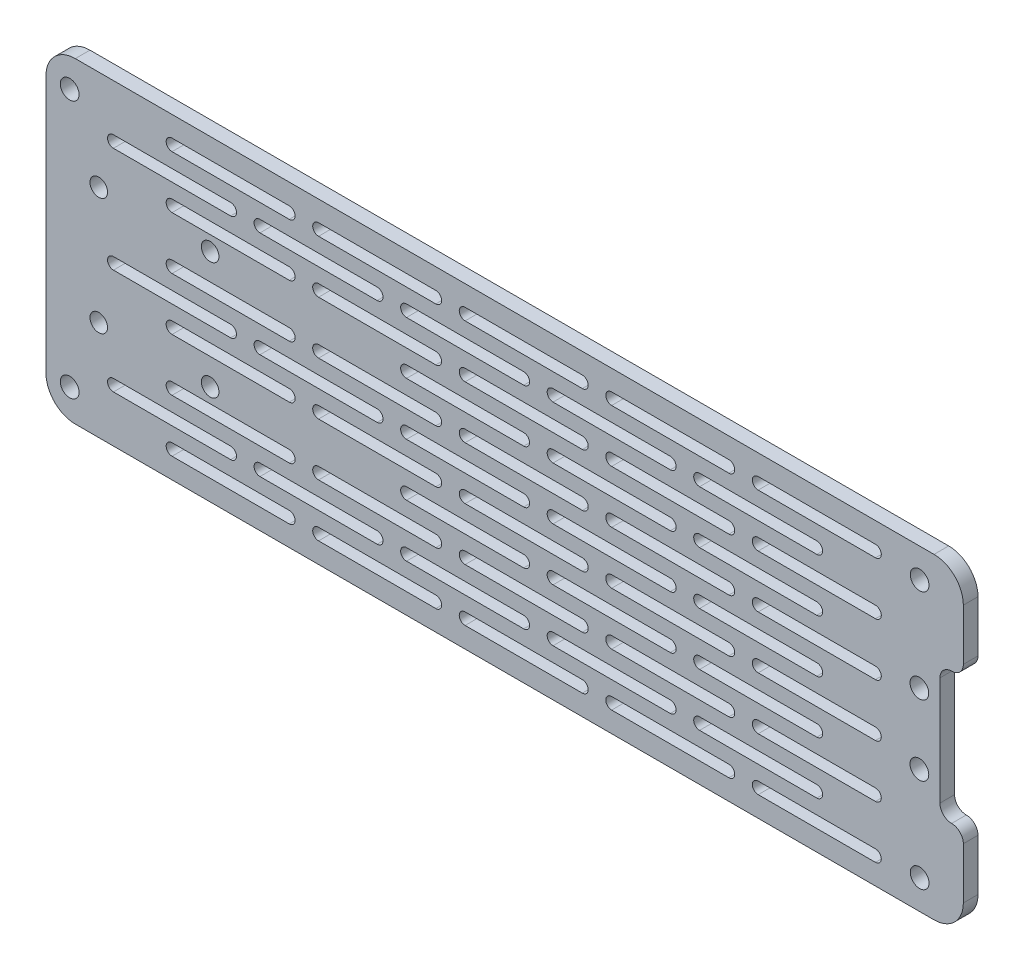
from build123d import *

# Parameters (mm, degrees)
SKETCH_1_W          = 156.5
SKETCH_1_H          = 54
EXTRUDE_1_DEPTH     = 2.5
FILLET_1_R          = 5
CUT_EXTRUDE_1_REACH = 159.625
SKETCH_2_R          = 1.6
SKETCH_2_W          = 4
SKETCH_2_H          = 22.5
SKETCH_2_R_2        = 1.5
FILLET_5_R          = 2
CUT_EXTRUDE_2_REACH = 159.625
SKETCH_3_R          = 1.6
CUT_EXTRUDE_3_DEPTH = 2.5


with BuildPart() as part:
    # 草图1 → 凸台-拉伸1 (new body)
    with BuildSketch(Plane.XY):
        with Locations((-74.950000012, 10)):
            Rectangle(SKETCH_1_W, SKETCH_1_H)
    extrude(amount=EXTRUDE_1_DEPTH)

    # 圆角1
    fillet_1_edges = [part.edges().sort_by_distance(p)[0] for p in [
        (3.299999988, -17, 1.25),
        (-153.200000012, -17, 1.25),
        (-153.200000012, 37, 1.25),
        (3.299999988, 37, 1.25),
    ]]
    fillet(fillet_1_edges, radius=FILLET_1_R)

    # 草图2 → 切除-拉伸1 (cut, up to next)
    with BuildSketch(Plane.XY.offset(2.5), mode=Mode.PRIVATE) as cut_extrude_1_sk1:
        with Locations(Location((-4.200000012, 16, 0), (0, 0, 180))):
            Circle(SKETCH_2_R)
    cut_extrude_1_tool1 = extrude(cut_extrude_1_sk1.sketch, amount=-CUT_EXTRUDE_1_REACH, mode=Mode.PRIVATE) & part.part
    # 草图2 → 切除-拉伸1 (cut, up to next)
    with BuildSketch(Plane.XY.offset(2.5), mode=Mode.PRIVATE) as cut_extrude_1_sk2:
        with Locations((-4.200000012, 4)):
            Circle(SKETCH_2_R)
    cut_extrude_1_tool2 = extrude(cut_extrude_1_sk2.sketch, amount=-CUT_EXTRUDE_1_REACH, mode=Mode.PRIVATE) & part.part
    # 草图2 → 切除-拉伸1 (cut, up to next)
    with BuildSketch(Plane.XY.offset(2.5), mode=Mode.PRIVATE) as cut_extrude_1_sk3:
        with Locations((1.299999988, 10)):
            Rectangle(SKETCH_2_W, SKETCH_2_H)
    cut_extrude_1_tool3 = extrude(cut_extrude_1_sk3.sketch, amount=-CUT_EXTRUDE_1_REACH, mode=Mode.PRIVATE) & part.part
    # 草图2 → 切除-拉伸1 (cut, up to next)
    with BuildSketch(Plane.XY.offset(2.5), mode=Mode.PRIVATE) as cut_extrude_1_sk4:
        with Locations((-144.200000012, 20)):
            Circle(SKETCH_2_R_2)
    cut_extrude_1_tool4 = extrude(cut_extrude_1_sk4.sketch, amount=-CUT_EXTRUDE_1_REACH, mode=Mode.PRIVATE) & part.part
    # 草图2 → 切除-拉伸1 (cut, up to next)
    with BuildSketch(Plane.XY.offset(2.5), mode=Mode.PRIVATE) as cut_extrude_1_sk5:
        with Locations((-125.200000012, 20)):
            Circle(SKETCH_2_R_2)
    cut_extrude_1_tool5 = extrude(cut_extrude_1_sk5.sketch, amount=-CUT_EXTRUDE_1_REACH, mode=Mode.PRIVATE) & part.part
    # 草图2 → 切除-拉伸1 (cut, up to next)
    with BuildSketch(Plane.XY.offset(2.5), mode=Mode.PRIVATE) as cut_extrude_1_sk6:
        with Locations(Location((-144.200000012, 0, 0), (0, 0, 180))):
            Circle(SKETCH_2_R_2)
    cut_extrude_1_tool6 = extrude(cut_extrude_1_sk6.sketch, amount=-CUT_EXTRUDE_1_REACH, mode=Mode.PRIVATE) & part.part
    # 草图2 → 切除-拉伸1 (cut, up to next)
    with BuildSketch(Plane.XY.offset(2.5), mode=Mode.PRIVATE) as cut_extrude_1_sk7:
        with Locations(Location((-125.200000012, 0, 0), (0, 0, 180))):
            Circle(SKETCH_2_R_2)
    cut_extrude_1_tool7 = extrude(cut_extrude_1_sk7.sketch, amount=-CUT_EXTRUDE_1_REACH, mode=Mode.PRIVATE) & part.part
    add(cut_extrude_1_tool1.solids().sort_by_distance((-4.2, 16, 2.5))[0], mode=Mode.SUBTRACT)
    add(cut_extrude_1_tool2.solids().sort_by_distance((-4.2, 4, 2.5))[0], mode=Mode.SUBTRACT)
    add(cut_extrude_1_tool3.solids().sort_by_distance((1.3, 10, 2.5))[0], mode=Mode.SUBTRACT)
    add(cut_extrude_1_tool4.solids().sort_by_distance((-144.2, 20, 2.5))[0], mode=Mode.SUBTRACT)
    add(cut_extrude_1_tool5.solids().sort_by_distance((-125.2, 20, 2.5))[0], mode=Mode.SUBTRACT)
    add(cut_extrude_1_tool6.solids().sort_by_distance((-144.2, 0, 2.5))[0], mode=Mode.SUBTRACT)
    add(cut_extrude_1_tool7.solids().sort_by_distance((-125.2, 0, 2.5))[0], mode=Mode.SUBTRACT)

    # 圆角5
    fillet_5_edges = [part.edges().sort_by_distance(p)[0] for p in [
        (-0.700000012, 21.25, 1.25),
        (-0.700000012, -1.25, 1.25),
    ]]
    fillet(fillet_5_edges, radius=FILLET_5_R)
    fillet_5_2_edges = [part.edges().sort_by_distance(p)[0] for p in [
        (3.299999988, 21.25, 1.25),
        (3.299999988, -1.25, 1.25),
    ]]
    fillet(fillet_5_2_edges, radius=FILLET_5_R - 0.0001)  # a hair under: the kernel refuses the full size

    # 草图3 → 切除-拉伸2 (cut, up to next)
    with BuildSketch(Plane.XY.offset(2.5), mode=Mode.PRIVATE) as cut_extrude_2_sk1:
        with Locations((-149.160040335, 32)):
            Circle(SKETCH_3_R)
    cut_extrude_2_tool1 = extrude(cut_extrude_2_sk1.sketch, amount=-CUT_EXTRUDE_2_REACH, mode=Mode.PRIVATE) & part.part
    # 草图3 → 切除-拉伸2 (cut, up to next)
    with BuildSketch(Plane.XY.offset(2.5), mode=Mode.PRIVATE) as cut_extrude_2_sk2:
        with Locations(Location((-149.160040335, -12, 0), (0, 0, 180))):
            Circle(SKETCH_3_R)
    cut_extrude_2_tool2 = extrude(cut_extrude_2_sk2.sketch, amount=-CUT_EXTRUDE_2_REACH, mode=Mode.PRIVATE) & part.part
    # 草图3 → 切除-拉伸2 (cut, up to next)
    with BuildSketch(Plane.XY.offset(2.5), mode=Mode.PRIVATE) as cut_extrude_2_sk3:
        with Locations(Location((-4.160040335, 32, 0), (0, 0, 180))):
            Circle(SKETCH_3_R)
    cut_extrude_2_tool3 = extrude(cut_extrude_2_sk3.sketch, amount=-CUT_EXTRUDE_2_REACH, mode=Mode.PRIVATE) & part.part
    # 草图3 → 切除-拉伸2 (cut, up to next)
    with BuildSketch(Plane.XY.offset(2.5), mode=Mode.PRIVATE) as cut_extrude_2_sk4:
        with Locations((-4.160040335, -12)):
            Circle(SKETCH_3_R)
    cut_extrude_2_tool4 = extrude(cut_extrude_2_sk4.sketch, amount=-CUT_EXTRUDE_2_REACH, mode=Mode.PRIVATE) & part.part
    add(cut_extrude_2_tool1.solids().sort_by_distance((-149.16004, 32, 2.5))[0], mode=Mode.SUBTRACT)
    add(cut_extrude_2_tool2.solids().sort_by_distance((-149.16004, -12, 2.5))[0], mode=Mode.SUBTRACT)
    add(cut_extrude_2_tool3.solids().sort_by_distance((-4.16004, 32, 2.5))[0], mode=Mode.SUBTRACT)
    add(cut_extrude_2_tool4.solids().sort_by_distance((-4.16004, -12, 2.5))[0], mode=Mode.SUBTRACT)

    # 草图4 → 切除-拉伸3 (cut)
    with BuildSketch(Plane.XY.offset(2.5)):
        with BuildLine():
            Line((-11.700000012, -13.5), (-31.700000012, -13.5))
            ThreePointArc((-31.700000012, -13.5), (-32.700000012, -12.5), (-31.700000012, -11.5))
            Line((-31.700000012, -11.5), (-11.700000012, -11.5))
            ThreePointArc((-11.700000012, -11.5), (-10.700000012, -12.5), (-11.700000012, -13.5))
        make_face()
        with BuildLine():
            Line((-11.700000012, -2.5), (-31.700000012, -2.5))
            ThreePointArc((-31.700000012, -2.5), (-32.700000012, -3.5), (-31.700000012, -4.5))
            Line((-31.700000012, -4.5), (-11.700000012, -4.5))
            ThreePointArc((-11.700000012, -4.5), (-10.700000012, -3.5), (-11.700000012, -2.5))
        make_face()
        with BuildLine():
            Line((-11.700000012, 6.5), (-31.700000012, 6.5))
            ThreePointArc((-31.700000012, 6.5), (-32.700000012, 5.5), (-31.700000012, 4.5))
            Line((-31.700000012, 4.5), (-11.700000012, 4.5))
            ThreePointArc((-11.700000012, 4.5), (-10.700000012, 5.5), (-11.700000012, 6.5))
        make_face()
        with BuildLine():
            Line((-11.700000012, 15.5), (-31.700000012, 15.5))
            ThreePointArc((-31.700000012, 15.5), (-32.700000012, 14.5), (-31.700000012, 13.5))
            Line((-31.700000012, 13.5), (-11.700000012, 13.5))
            ThreePointArc((-11.700000012, 13.5), (-10.700000012, 14.5), (-11.700000012, 15.5))
        make_face()
        with BuildLine():
            Line((-11.700000012, 24.5), (-31.700000012, 24.5))
            ThreePointArc((-31.700000012, 24.5), (-32.700000012, 23.5), (-31.700000012, 22.5))
            Line((-31.700000012, 22.5), (-11.700000012, 22.5))
            ThreePointArc((-11.700000012, 22.5), (-10.700000012, 23.5), (-11.700000012, 24.5))
        make_face()
        with BuildLine():
            Line((-11.700000012, 33.5), (-31.700000012, 33.5))
            ThreePointArc((-31.700000012, 33.5), (-32.700000012, 32.5), (-31.700000012, 31.5))
            Line((-31.700000012, 31.5), (-11.700000012, 31.5))
            ThreePointArc((-11.700000012, 31.5), (-10.700000012, 32.5), (-11.700000012, 33.5))
        make_face()
        with BuildLine():
            Line((-41.700000012, -7), (-21.700000012, -7))
            ThreePointArc((-21.700000012, -7), (-20.700000012, -8), (-21.700000012, -9))
            Line((-21.700000012, -9), (-41.700000012, -9))
            ThreePointArc((-41.700000012, -9), (-42.700000012, -8), (-41.700000012, -7))
        make_face()
        with BuildLine():
            Line((-41.700000012, 0), (-21.700000012, 0))
            ThreePointArc((-21.700000012, 0), (-20.700000012, 1), (-21.700000012, 2))
            Line((-21.700000012, 2), (-41.700000012, 2))
            ThreePointArc((-41.700000012, 2), (-42.700000012, 1), (-41.700000012, 0))
        make_face()
        with BuildLine():
            Line((-41.700000012, 9), (-21.700000012, 9))
            ThreePointArc((-21.700000012, 9), (-20.700000012, 10), (-21.700000012, 11))
            Line((-21.700000012, 11), (-41.700000012, 11))
            ThreePointArc((-41.700000012, 11), (-42.700000012, 10), (-41.700000012, 9))
        make_face()
        with BuildLine():
            Line((-41.700000012, 18), (-21.700000012, 18))
            ThreePointArc((-21.700000012, 18), (-20.700000012, 19), (-21.700000012, 20))
            Line((-21.700000012, 20), (-41.700000012, 20))
            ThreePointArc((-41.700000012, 20), (-42.700000012, 19), (-41.700000012, 18))
        make_face()
        with BuildLine():
            Line((-41.700000012, 27), (-21.700000012, 27))
            ThreePointArc((-21.700000012, 27), (-20.700000012, 28), (-21.700000012, 29))
            Line((-21.700000012, 29), (-41.700000012, 29))
            ThreePointArc((-41.700000012, 29), (-42.700000012, 28), (-41.700000012, 27))
        make_face()
        with BuildLine():
            Line((-36.700000012, -13.5), (-56.700000012, -13.5))
            ThreePointArc((-56.700000012, -13.5), (-57.700000012, -12.5), (-56.700000012, -11.5))
            Line((-56.700000012, -11.5), (-36.700000012, -11.5))
            ThreePointArc((-36.700000012, -11.5), (-35.700000012, -12.5), (-36.700000012, -13.5))
        make_face()
        with BuildLine():
            Line((-36.700000012, -4.5), (-56.700000012, -4.5))
            ThreePointArc((-56.700000012, -4.5), (-57.700000012, -3.5), (-56.700000012, -2.5))
            Line((-56.700000012, -2.5), (-36.700000012, -2.5))
            ThreePointArc((-36.700000012, -2.5), (-35.700000012, -3.5), (-36.700000012, -4.5))
        make_face()
        with BuildLine():
            Line((-36.700000012, 4.5), (-56.700000012, 4.5))
            ThreePointArc((-56.700000012, 4.5), (-57.700000012, 5.5), (-56.700000012, 6.5))
            Line((-56.700000012, 6.5), (-36.700000012, 6.5))
            ThreePointArc((-36.700000012, 6.5), (-35.700000012, 5.5), (-36.700000012, 4.5))
        make_face()
        with BuildLine():
            Line((-36.700000012, 13.5), (-56.700000012, 13.5))
            ThreePointArc((-56.700000012, 13.5), (-57.700000012, 14.5), (-56.700000012, 15.5))
            Line((-56.700000012, 15.5), (-36.700000012, 15.5))
            ThreePointArc((-36.700000012, 15.5), (-35.700000012, 14.5), (-36.700000012, 13.5))
        make_face()
        with BuildLine():
            Line((-36.700000012, 22.5), (-56.700000012, 22.5))
            ThreePointArc((-56.700000012, 22.5), (-57.700000012, 23.5), (-56.700000012, 24.5))
            Line((-56.700000012, 24.5), (-36.700000012, 24.5))
            ThreePointArc((-36.700000012, 24.5), (-35.700000012, 23.5), (-36.700000012, 22.5))
        make_face()
        with BuildLine():
            Line((-36.700000012, 31.5), (-56.700000012, 31.5))
            ThreePointArc((-56.700000012, 31.5), (-57.700000012, 32.5), (-56.700000012, 33.5))
            Line((-56.700000012, 33.5), (-36.700000012, 33.5))
            ThreePointArc((-36.700000012, 33.5), (-35.700000012, 32.5), (-36.700000012, 31.5))
        make_face()
        with BuildLine():
            Line((-66.700000012, -7), (-46.700000012, -7))
            ThreePointArc((-46.700000012, -7), (-45.700000012, -8), (-46.700000012, -9))
            Line((-46.700000012, -9), (-66.700000012, -9))
            ThreePointArc((-66.700000012, -9), (-67.700000012, -8), (-66.700000012, -7))
        make_face()
        with BuildLine():
            Line((-66.700000012, 2), (-46.700000012, 2))
            ThreePointArc((-46.700000012, 2), (-45.700000012, 1), (-46.700000012, 0))
            Line((-46.700000012, 0), (-66.700000012, 0))
            ThreePointArc((-66.700000012, 0), (-67.700000012, 1), (-66.700000012, 2))
        make_face()
        with BuildLine():
            Line((-66.700000012, 11), (-46.700000012, 11))
            ThreePointArc((-46.700000012, 11), (-45.700000012, 10), (-46.700000012, 9))
            Line((-46.700000012, 9), (-66.700000012, 9))
            ThreePointArc((-66.700000012, 9), (-67.700000012, 10), (-66.700000012, 11))
        make_face()
        with BuildLine():
            Line((-66.700000012, 20), (-46.700000012, 20))
            ThreePointArc((-46.700000012, 20), (-45.700000012, 19), (-46.700000012, 18))
            Line((-46.700000012, 18), (-66.700000012, 18))
            ThreePointArc((-66.700000012, 18), (-67.700000012, 19), (-66.700000012, 20))
        make_face()
        with BuildLine():
            Line((-66.700000012, 29), (-46.700000012, 29))
            ThreePointArc((-46.700000012, 29), (-45.700000012, 28), (-46.700000012, 27))
            Line((-46.700000012, 27), (-66.700000012, 27))
            ThreePointArc((-66.700000012, 27), (-67.700000012, 28), (-66.700000012, 29))
        make_face()
        with BuildLine():
            Line((-61.700000012, -13.5), (-81.700000012, -13.5))
            ThreePointArc((-81.700000012, -13.5), (-82.700000012, -12.5), (-81.700000012, -11.5))
            Line((-81.700000012, -11.5), (-61.700000012, -11.5))
            ThreePointArc((-61.700000012, -11.5), (-60.700000012, -12.5), (-61.700000012, -13.5))
        make_face()
        with BuildLine():
            Line((-61.700000012, -4.5), (-81.700000012, -4.5))
            ThreePointArc((-81.700000012, -4.5), (-82.700000012, -3.5), (-81.700000012, -2.5))
            Line((-81.700000012, -2.5), (-61.700000012, -2.5))
            ThreePointArc((-61.700000012, -2.5), (-60.700000012, -3.5), (-61.700000012, -4.5))
        make_face()
        with BuildLine():
            Line((-61.700000012, 4.5), (-81.700000012, 4.5))
            ThreePointArc((-81.700000012, 4.5), (-82.700000012, 5.5), (-81.700000012, 6.5))
            Line((-81.700000012, 6.5), (-61.700000012, 6.5))
            ThreePointArc((-61.700000012, 6.5), (-60.700000012, 5.5), (-61.700000012, 4.5))
        make_face()
        with BuildLine():
            Line((-61.700000012, 13.5), (-81.700000012, 13.5))
            ThreePointArc((-81.700000012, 13.5), (-82.700000012, 14.5), (-81.700000012, 15.5))
            Line((-81.700000012, 15.5), (-61.700000012, 15.5))
            ThreePointArc((-61.700000012, 15.5), (-60.700000012, 14.5), (-61.700000012, 13.5))
        make_face()
        with BuildLine():
            Line((-61.700000012, 22.5), (-81.700000012, 22.5))
            ThreePointArc((-81.700000012, 22.5), (-82.700000012, 23.5), (-81.700000012, 24.5))
            Line((-81.700000012, 24.5), (-61.700000012, 24.5))
            ThreePointArc((-61.700000012, 24.5), (-60.700000012, 23.5), (-61.700000012, 22.5))
        make_face()
        with BuildLine():
            Line((-61.700000012, 31.5), (-81.700000012, 31.5))
            ThreePointArc((-81.700000012, 31.5), (-82.700000012, 32.5), (-81.700000012, 33.5))
            Line((-81.700000012, 33.5), (-61.700000012, 33.5))
            ThreePointArc((-61.700000012, 33.5), (-60.700000012, 32.5), (-61.700000012, 31.5))
        make_face()
        with BuildLine():
            Line((-91.700000012, -7), (-71.700000012, -7))
            ThreePointArc((-71.700000012, -7), (-70.700000012, -8), (-71.700000012, -9))
            Line((-71.700000012, -9), (-91.700000012, -9))
            ThreePointArc((-91.700000012, -9), (-92.700000012, -8), (-91.700000012, -7))
        make_face()
        with BuildLine():
            Line((-91.700000012, 2), (-71.700000012, 2))
            ThreePointArc((-71.700000012, 2), (-70.700000012, 1), (-71.700000012, 0))
            Line((-71.700000012, 0), (-91.700000012, 0))
            ThreePointArc((-91.700000012, 0), (-92.700000012, 1), (-91.700000012, 2))
        make_face()
        with BuildLine():
            Line((-91.700000012, 11), (-71.700000012, 11))
            ThreePointArc((-71.700000012, 11), (-70.700000012, 10), (-71.700000012, 9))
            Line((-71.700000012, 9), (-91.700000012, 9))
            ThreePointArc((-91.700000012, 9), (-92.700000012, 10), (-91.700000012, 11))
        make_face()
        with BuildLine():
            Line((-91.700000012, 20), (-71.700000012, 20))
            ThreePointArc((-71.700000012, 20), (-70.700000012, 19), (-71.700000012, 18))
            Line((-71.700000012, 18), (-91.700000012, 18))
            ThreePointArc((-91.700000012, 18), (-92.700000012, 19), (-91.700000012, 20))
        make_face()
        with BuildLine():
            Line((-91.700000012, 29), (-71.700000012, 29))
            ThreePointArc((-71.700000012, 29), (-70.700000012, 28), (-71.700000012, 27))
            Line((-71.700000012, 27), (-91.700000012, 27))
            ThreePointArc((-91.700000012, 27), (-92.700000012, 28), (-91.700000012, 29))
        make_face()
        with BuildLine():
            Line((-86.700000012, -13.5), (-106.700000012, -13.5))
            ThreePointArc((-106.700000012, -13.5), (-107.700000012, -12.5), (-106.700000012, -11.5))
            Line((-106.700000012, -11.5), (-86.700000012, -11.5))
            ThreePointArc((-86.700000012, -11.5), (-85.700000012, -12.5), (-86.700000012, -13.5))
        make_face()
        with BuildLine():
            Line((-86.700000012, -4.5), (-106.700000012, -4.5))
            ThreePointArc((-106.700000012, -4.5), (-107.700000012, -3.5), (-106.700000012, -2.5))
            Line((-106.700000012, -2.5), (-86.700000012, -2.5))
            ThreePointArc((-86.700000012, -2.5), (-85.700000012, -3.5), (-86.700000012, -4.5))
        make_face()
        with BuildLine():
            Line((-86.700000012, 4.5), (-106.700000012, 4.5))
            ThreePointArc((-106.700000012, 4.5), (-107.700000012, 5.5), (-106.700000012, 6.5))
            Line((-106.700000012, 6.5), (-86.700000012, 6.5))
            ThreePointArc((-86.700000012, 6.5), (-85.700000012, 5.5), (-86.700000012, 4.5))
        make_face()
        with BuildLine():
            Line((-86.700000012, 13.5), (-106.700000012, 13.5))
            ThreePointArc((-106.700000012, 13.5), (-107.700000012, 14.5), (-106.700000012, 15.5))
            Line((-106.700000012, 15.5), (-86.700000012, 15.5))
            ThreePointArc((-86.700000012, 15.5), (-85.700000012, 14.5), (-86.700000012, 13.5))
        make_face()
        with BuildLine():
            Line((-86.700000012, 22.5), (-106.700000012, 22.5))
            ThreePointArc((-106.700000012, 22.5), (-107.700000012, 23.5), (-106.700000012, 24.5))
            Line((-106.700000012, 24.5), (-86.700000012, 24.5))
            ThreePointArc((-86.700000012, 24.5), (-85.700000012, 23.5), (-86.700000012, 22.5))
        make_face()
        with BuildLine():
            Line((-86.700000012, 31.5), (-106.700000012, 31.5))
            ThreePointArc((-106.700000012, 31.5), (-107.700000012, 32.5), (-106.700000012, 33.5))
            Line((-106.700000012, 33.5), (-86.700000012, 33.5))
            ThreePointArc((-86.700000012, 33.5), (-85.700000012, 32.5), (-86.700000012, 31.5))
        make_face()
        with BuildLine():
            Line((-111.700000012, -13.5), (-131.700000012, -13.5))
            ThreePointArc((-131.700000012, -13.5), (-132.700000012, -12.5), (-131.700000012, -11.5))
            Line((-131.700000012, -11.5), (-111.700000012, -11.5))
            ThreePointArc((-111.700000012, -11.5), (-110.700000012, -12.5), (-111.700000012, -13.5))
        make_face()
        with BuildLine():
            Line((-111.700000012, -4.5), (-131.700000012, -4.5))
            ThreePointArc((-131.700000012, -4.5), (-132.700000012, -3.5), (-131.700000012, -2.5))
            Line((-131.700000012, -2.5), (-111.700000012, -2.5))
            ThreePointArc((-111.700000012, -2.5), (-110.700000012, -3.5), (-111.700000012, -4.5))
        make_face()
        with BuildLine():
            Line((-111.700000012, 4.5), (-131.700000012, 4.5))
            ThreePointArc((-131.700000012, 4.5), (-132.700000012, 5.5), (-131.700000012, 6.5))
            Line((-131.700000012, 6.5), (-111.700000012, 6.5))
            ThreePointArc((-111.700000012, 6.5), (-110.700000012, 5.5), (-111.700000012, 4.5))
        make_face()
        with BuildLine():
            Line((-111.700000012, 13.5), (-131.700000012, 13.5))
            ThreePointArc((-131.700000012, 13.5), (-132.700000012, 14.5), (-131.700000012, 15.5))
            Line((-131.700000012, 15.5), (-111.700000012, 15.5))
            ThreePointArc((-111.700000012, 15.5), (-110.700000012, 14.5), (-111.700000012, 13.5))
        make_face()
        with BuildLine():
            Line((-111.700000012, 22.5), (-131.700000012, 22.5))
            ThreePointArc((-131.700000012, 22.5), (-132.700000012, 23.5), (-131.700000012, 24.5))
            Line((-131.700000012, 24.5), (-111.700000012, 24.5))
            ThreePointArc((-111.700000012, 24.5), (-110.700000012, 23.5), (-111.700000012, 22.5))
        make_face()
        with BuildLine():
            Line((-111.700000012, 31.5), (-131.700000012, 31.5))
            ThreePointArc((-131.700000012, 31.5), (-132.700000012, 32.5), (-131.700000012, 33.5))
            Line((-131.700000012, 33.5), (-111.700000012, 33.5))
            ThreePointArc((-111.700000012, 33.5), (-110.700000012, 32.5), (-111.700000012, 31.5))
        make_face()
        with BuildLine():
            Line((-116.700000012, -7), (-96.700000012, -7))
            ThreePointArc((-96.700000012, -7), (-95.700000012, -8), (-96.700000012, -9))
            Line((-96.700000012, -9), (-116.700000012, -9))
            ThreePointArc((-116.700000012, -9), (-117.700000012, -8), (-116.700000012, -7))
        make_face()
        with BuildLine():
            Line((-116.700000012, 11), (-96.700000012, 11))
            ThreePointArc((-96.700000012, 11), (-95.700000012, 10), (-96.700000012, 9))
            Line((-96.700000012, 9), (-116.700000012, 9))
            ThreePointArc((-116.700000012, 9), (-117.700000012, 10), (-116.700000012, 11))
        make_face()
        with BuildLine():
            Line((-116.700000012, 29), (-96.700000012, 29))
            ThreePointArc((-96.700000012, 29), (-95.700000012, 28), (-96.700000012, 27))
            Line((-96.700000012, 27), (-116.700000012, 27))
            ThreePointArc((-116.700000012, 27), (-117.700000012, 28), (-116.700000012, 29))
        make_face()
        with BuildLine():
            Line((-141.700000012, -7), (-121.700000012, -7))
            ThreePointArc((-121.700000012, -7), (-120.700000012, -8), (-121.700000012, -9))
            Line((-121.700000012, -9), (-141.700000012, -9))
            ThreePointArc((-141.700000012, -9), (-142.700000012, -8), (-141.700000012, -7))
        make_face()
        with BuildLine():
            Line((-141.700000012, 11), (-121.700000012, 11))
            ThreePointArc((-121.700000012, 11), (-120.700000012, 10), (-121.700000012, 9))
            Line((-121.700000012, 9), (-141.700000012, 9))
            ThreePointArc((-141.700000012, 9), (-142.700000012, 10), (-141.700000012, 11))
        make_face()
        with BuildLine():
            Line((-141.700000012, 29), (-121.700000012, 29))
            ThreePointArc((-121.700000012, 29), (-120.700000012, 28), (-121.700000012, 27))
            Line((-121.700000012, 27), (-141.700000012, 27))
            ThreePointArc((-141.700000012, 27), (-142.700000012, 28), (-141.700000012, 29))
        make_face()
    extrude(amount=-CUT_EXTRUDE_3_DEPTH, mode=Mode.SUBTRACT)


solid = part.part
